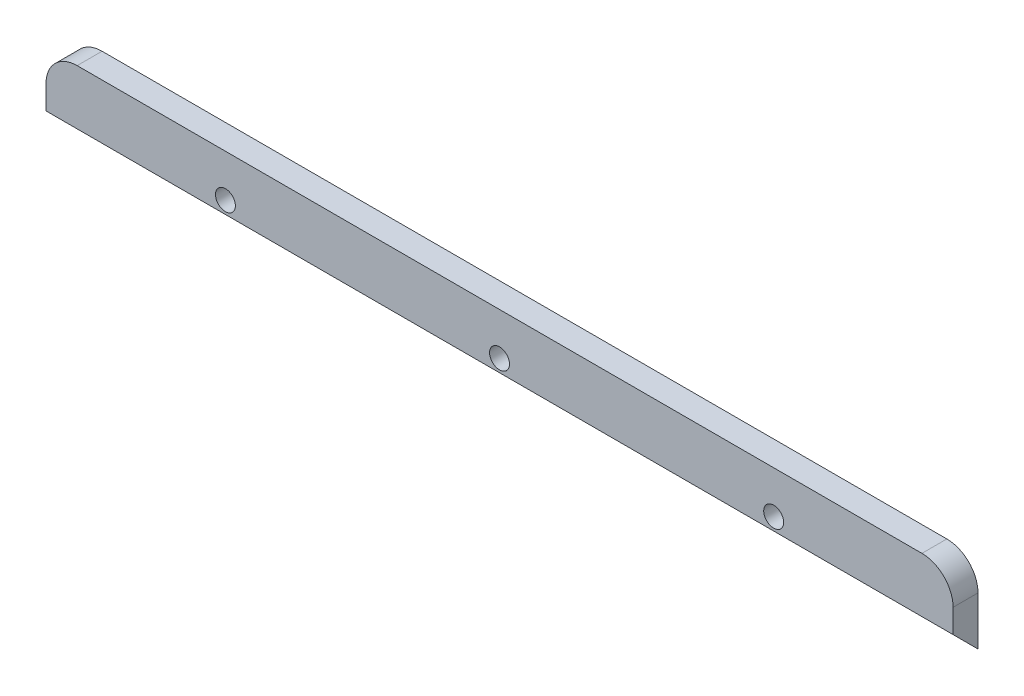
from build123d import *

# Parameters (mm, degrees)
BOSS_EXTRUDE1_DEPTH   = 36.4
M2X0_4_TAPPED_HOLE1_D = 1.6
FILLET3_R             = 2.5


with BuildPart() as part:
    # Sketch1 → Boss-Extrude1 (new, symmetric)
    with BuildSketch(Plane(origin=(0, 0, 0), x_dir=(0, 0, -1), z_dir=(1, 0, 0))):
        Polygon((0, -3.2), (-2, -1.2), (-2, 3.2), (0, 3.2), align=None)
    extrude(amount=BOSS_EXTRUDE1_DEPTH, both=True)

    # M2x0.4 Tapped Hole1 (through all)
    with Locations(Plane.XY.offset(2)):
        with Locations((22, -0.2), (0, -0.2), (-22, -0.2)):
            Hole(M2X0_4_TAPPED_HOLE1_D / 2)

    # Fillet3
    fillet3_edges = [part.edges().sort_by_distance(p)[0] for p in [
        (-36.4, 3.2, 1),
        (36.4, 3.2, 1),
    ]]
    fillet(fillet3_edges, radius=FILLET3_R)


solid = part.part
